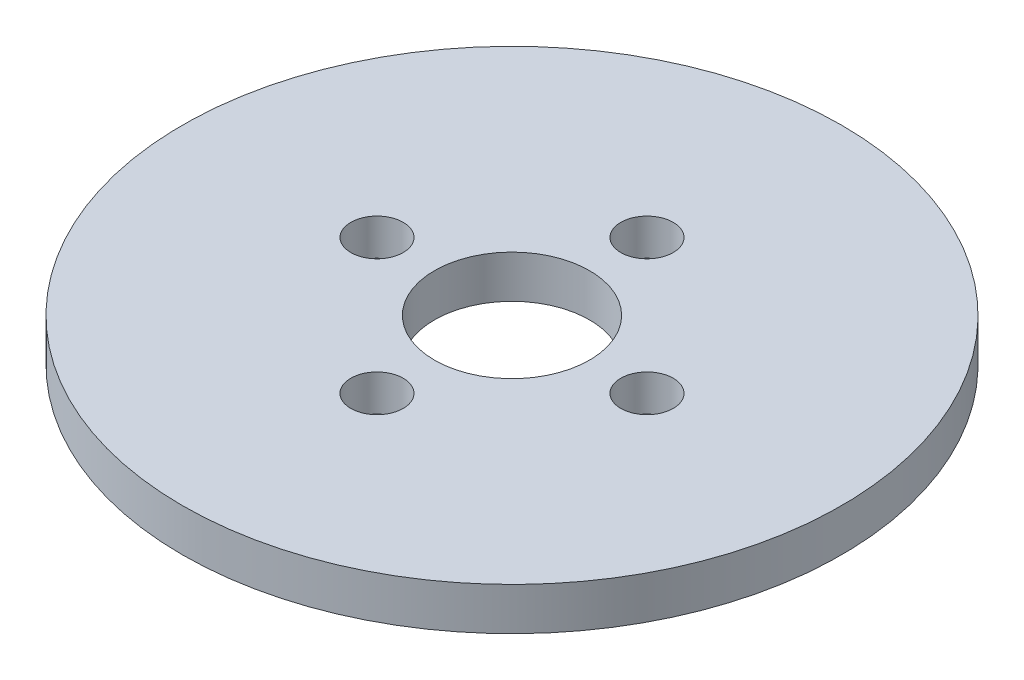
from build123d import *

# Parameters (mm, degrees)
SKETCH1_R           = 85
BOSS_EXTRUDE1_DEPTH = 11
SKETCH2_R           = 20
CUT_EXTRUDE1_DEPTH  = 121.710397232
SKETCH3_R           = 6.758012093
CUT_EXTRUDE2_DEPTH  = 9.414464531
CIRPATTERN1_COUNT   = 4


with BuildPart() as part:
    # Sketch1 → Boss-Extrude1 (new body)
    with BuildSketch(Plane(origin=(0, 0, 0), x_dir=(1, 0, 0), z_dir=(0, 1, 0))):
        Circle(SKETCH1_R)
    extrude(amount=BOSS_EXTRUDE1_DEPTH)

    # Sketch2 → Cut-Extrude1 (cut, through all)
    with BuildSketch(Plane(origin=(0, 0, 0), x_dir=(1, 0, 0), z_dir=(0, 1, 0))):
        Circle(SKETCH2_R)
    extrude(amount=CUT_EXTRUDE1_DEPTH, mode=Mode.SUBTRACT)

    # Sketch3 → Cut-Extrude2 (cut)
    with BuildSketch(Plane(origin=(0, 11, 0), x_dir=(1, 0, 0), z_dir=(0, 1, 0))):
        with Locations((-34.818888407, 0)):
            Circle(SKETCH3_R)
    cut_extrude2 = extrude(amount=-CUT_EXTRUDE2_DEPTH, mode=Mode.SUBTRACT)

    # CirPattern1: Cut-Extrude2 ×4 about axis
    cirpattern1_axis = Axis((0, 0, 0), (0, 1, 0))
    for i in range(1, CIRPATTERN1_COUNT):
        add(cut_extrude2.rotate(cirpattern1_axis, i * 360 / CIRPATTERN1_COUNT), mode=Mode.SUBTRACT)


solid = part.part
